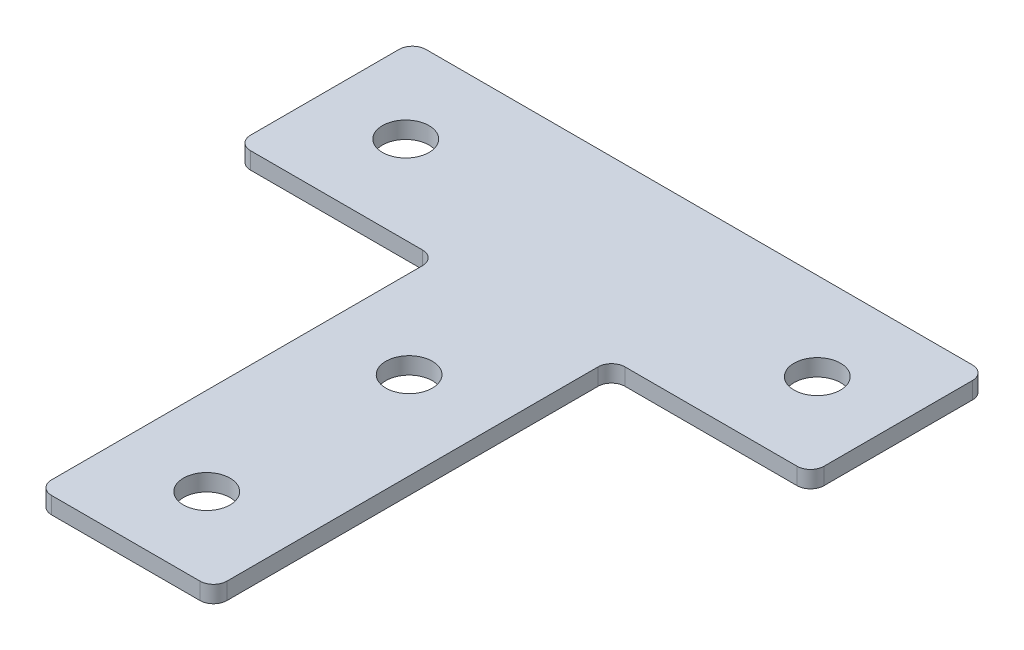
from build123d import *

# Parameters (mm, degrees)
SKETCH_1_R      = 3.45
EXTRUDE_1_DEPTH = 2.5
FILLET_1_R      = 2


with BuildPart() as part:
    # 草图1 → 凸台-拉伸1 (new body)
    with BuildSketch(Plane(origin=(0, 0, 0), x_dir=(1, 0, 0), z_dir=(0, 1, 0))):
        Polygon((13, -13), (42.5, -13), (42.5, 13), (-42.5, 13), (-42.5, -13), (-13, -13), (-13, -72), (13, -72), align=None)
        with Locations((0, -60)):
            Circle(SKETCH_1_R, mode=Mode.SUBTRACT)
        with Locations((0, -30)):
            Circle(SKETCH_1_R, mode=Mode.SUBTRACT)
        with Locations((-30.5, 0)):
            Circle(SKETCH_1_R, mode=Mode.SUBTRACT)
        with Locations((30.5, 0)):
            Circle(SKETCH_1_R, mode=Mode.SUBTRACT)
    extrude(amount=EXTRUDE_1_DEPTH)

    # 圆角1
    fillet_1_edges = [part.edges().sort_by_distance(p)[0] for p in [
        (13, 1.25, 72),
        (-13, 1.25, 72),
        (-13, 1.25, 13),
        (-42.5, 1.25, 13),
        (13, 1.25, 13),
        (42.5, 1.25, 13),
        (42.5, 1.25, -13),
        (-42.5, 1.25, -13),
    ]]
    fillet(fillet_1_edges, radius=FILLET_1_R)


solid = part.part
